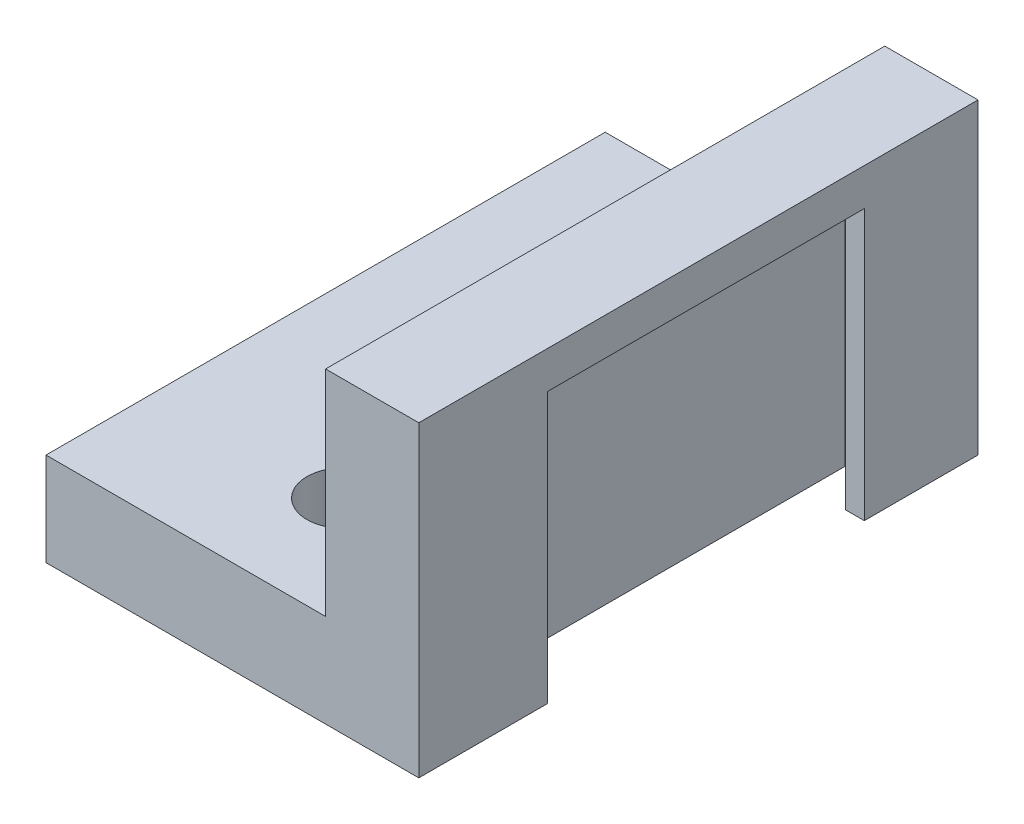
from build123d import *

# Parameters (mm, degrees)
SALIENTE_EXTRUIR1_DEPTH = 30
CORTAR_EXTRUIR1_REACH   = 40.862
CORTAR_EXTRUIR2_REACH   = 39.286
CROQUIS3_R              = 2
CROQUIS4_R              = 3.25
CORTAR_EXTRUIR3_DEPTH   = 2
CROQUIS5_W              = 5
CROQUIS5_H              = 30
SALIENTE_EXTRUIR2_DEPTH = 2


with BuildPart() as part:
    # Croquis1 → Saliente-Extruir1 (new body)
    with BuildSketch(Plane.XY):
        Polygon((20, 0), (20, 14.5), (15, 14.5), (15, 5), (0, 5), (0, 0), align=None)
    extrude(amount=SALIENTE_EXTRUIR1_DEPTH)

    # Croquis2 → Cortar-Extruir1 (cut, up to next)
    with BuildSketch(Plane(origin=(0, 14.5, 0), x_dir=(1, 0, 0), z_dir=(0, 1, 0)), mode=Mode.PRIVATE) as cortar_extruir1_sk1:
        Polygon((20, -23.1), (20, -15), (20, -6.1), (19, -6.1), (19, -4.1), (16.96, -4.1), (16.96, -25.1), (19, -25.1), (19, -23.1), align=None)
    cortar_extruir1_tool1 = extrude(cortar_extruir1_sk1.sketch, amount=-CORTAR_EXTRUIR1_REACH, mode=Mode.PRIVATE) & part.part
    add(cortar_extruir1_tool1.solids().sort_by_distance((18.411818, 14.5, 14.6))[0], mode=Mode.SUBTRACT)

    # Croquis3 → Cortar-Extruir2 (cut, up to next)
    with BuildSketch(Plane(origin=(0, 5, 0), x_dir=(1, 0, 0), z_dir=(0, 1, 0)), mode=Mode.PRIVATE) as cortar_extruir2_sk1:
        with Locations((10, -6)):
            Circle(CROQUIS3_R)
    cortar_extruir2_tool1 = extrude(cortar_extruir2_sk1.sketch, amount=-CORTAR_EXTRUIR2_REACH, mode=Mode.PRIVATE) & part.part
    # Croquis3 → Cortar-Extruir2 (cut, up to next)
    with BuildSketch(Plane(origin=(0, 5, 0), x_dir=(1, 0, 0), z_dir=(0, 1, 0)), mode=Mode.PRIVATE) as cortar_extruir2_sk2:
        with Locations((10, -24)):
            Circle(CROQUIS3_R)
    cortar_extruir2_tool2 = extrude(cortar_extruir2_sk2.sketch, amount=-CORTAR_EXTRUIR2_REACH, mode=Mode.PRIVATE) & part.part
    add(cortar_extruir2_tool1.solids().sort_by_distance((10, 5, 6))[0], mode=Mode.SUBTRACT)
    add(cortar_extruir2_tool2.solids().sort_by_distance((10, 5, 24))[0], mode=Mode.SUBTRACT)

    # Croquis4 → Cortar-Extruir3 (cut)
    with BuildSketch(Plane.XZ):
        with Locations((10, 24)):
            Circle(CROQUIS4_R)
        with Locations((10, 6)):
            Circle(CROQUIS4_R)
    extrude(amount=-CORTAR_EXTRUIR3_DEPTH, mode=Mode.SUBTRACT)

    # Croquis5 → Saliente-Extruir2 (add)
    with BuildSketch(Plane(origin=(0, 14.5, 0), x_dir=(1, 0, 0), z_dir=(0, 1, 0))):
        with Locations((17.5, -15)):
            Rectangle(CROQUIS5_W, CROQUIS5_H)
    extrude(amount=SALIENTE_EXTRUIR2_DEPTH)


solid = part.part
